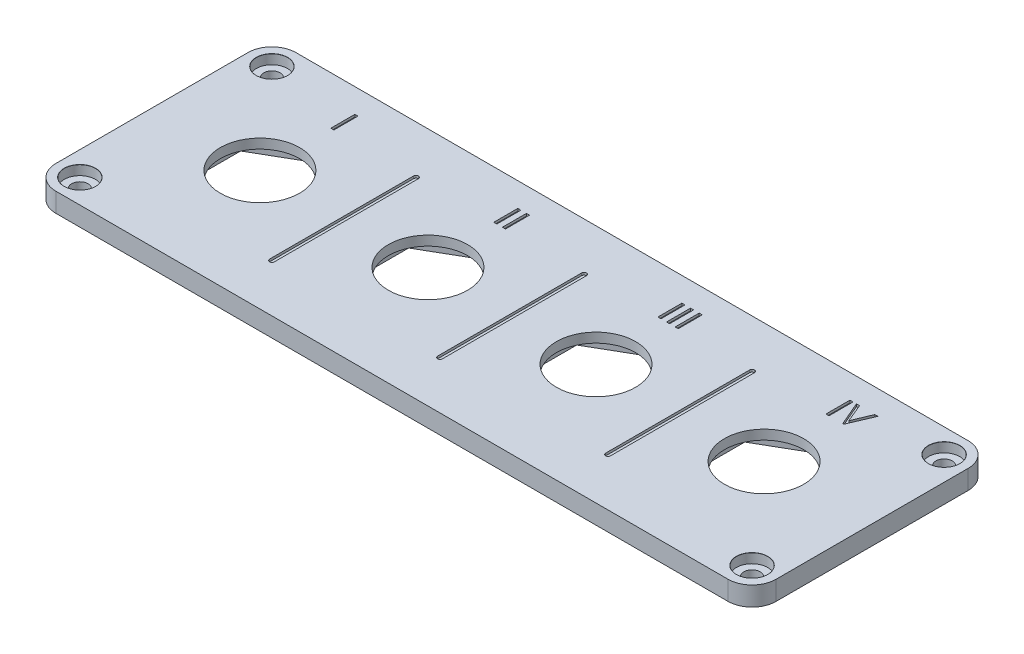
from build123d import *

# Parameters (mm, degrees)
SKETCH1_W              = 150
SKETCH1_H              = 50
BODY_DEPTH             = 4
EDGE_FILLETS_R         = 5
GX16_HOLE_D            = 16.5
GX16_NUT_CUTOUT_DEPTH  = 2
GX16_PATTERN_COUNT     = 4
GX16_PATTERN_PITCH     = 35
DESIGN_CUTOUT_SKETCH_W = 0.641025641
DESIGN_CUTOUT_SKETCH_H = 5
DESIGN_CUTOUT_DEPTH    = 0.5


# Read off the part's stored shape, not the designer's step: mounting_holes
with BuildPart() as part:
    # Sketch1 → body (new body)
    with BuildSketch(Plane(origin=(0, 0, 0), x_dir=(1, 0, 0), z_dir=(0, 1, 0))):
        Rectangle(SKETCH1_W, SKETCH1_H)
    extrude(amount=BODY_DEPTH)

    # mounting_holes outline → mounting_holes (revolve, cut)
    with BuildSketch(Plane(origin=(70, 0, 20), x_dir=(1, 0, 0), z_dir=(0, 0, 1))):
        Polygon((0, 0), (1.7, 0), (1.7, 2), (3.25, 2), (3.25, 3.975), (3.275, 4), (0, 4), align=None)
    revolve(axis=Axis((70, 0, 20), (0, 1, 0)), mode=Mode.SUBTRACT)

    # mounting_holes 2 outline → mounting_holes 2 (revolve, cut)
    with BuildSketch(Plane(origin=(-70, 0, -20), x_dir=(1, 0, 0), z_dir=(0, 0, 1))):
        Polygon((0, 4), (0, 0), (1.7, 0), (1.7, 2), (3.25, 2), (3.25, 3.975), (3.275, 4), align=None)
    revolve(axis=Axis((-70, 0, -20), (0, 1, 0)), mode=Mode.SUBTRACT)

    # mounting_holes 3 outline → mounting_holes 3 (revolve, cut)
    with BuildSketch(Plane(origin=(70, 0, -20), x_dir=(1, 0, 0), z_dir=(0, 0, 1))):
        Polygon((0, 4), (0, 0), (1.7, 0), (1.7, 2), (3.25, 2), (3.25, 3.975), (3.275, 4), align=None)
    revolve(axis=Axis((70, 0, -20), (0, 1, 0)), mode=Mode.SUBTRACT)

    # mounting_holes 4 outline → mounting_holes 4 (revolve, cut)
    with BuildSketch(Plane(origin=(-70, 0, 20), x_dir=(1, 0, 0), z_dir=(0, 0, 1))):
        Polygon((0, 4), (0, 0), (1.7, 0), (1.7, 2), (3.25, 2), (3.25, 3.975), (3.275, 4), align=None)
    revolve(axis=Axis((-70, 0, 20), (0, 1, 0)), mode=Mode.SUBTRACT)

    # edge_fillets
    edge_fillets_edges = [part.edges().sort_by_distance(p)[0] for p in [
        (75, 2, 25),
        (-75, 2, 25),
        (-75, 2, -25),
        (75, 2, -25),
    ]]
    fillet(edge_fillets_edges, radius=EDGE_FILLETS_R)

    # gx16_hole (through all)
    with Locations(Plane(origin=(0, 4, 0), x_dir=(1, 0, 0), z_dir=(0, 1, 0))):
        with Locations((-52.5, 0)):
            gx16_hole = Hole(GX16_HOLE_D / 2)

    # Sketch6 → gx16_nut-cutout (cut)
    with BuildSketch(Plane.XZ):
        Polygon((-52.5, 10.969655115), (-62, 5.484827557), (-62, -5.484827557), (-52.5, -10.969655115), (-43, -5.484827557), (-43, 5.484827557), align=None)
    gx16_nut_cutout = extrude(amount=-GX16_NUT_CUTOUT_DEPTH, mode=Mode.SUBTRACT)

    # gx16_pattern: gx16_hole, gx16_nut-cutout ×4
    with Locations(*[(i * GX16_PATTERN_PITCH, 0, 0) for i in range(1, GX16_PATTERN_COUNT)]):
        add(gx16_hole, mode=Mode.SUBTRACT)
        add(gx16_nut_cutout, mode=Mode.SUBTRACT)

    # design_cutout_sketch → design_cutout (cut)
    with BuildSketch(Plane(origin=(0, 4, 0), x_dir=(1, 0, 0), z_dir=(0, 1, 0))):
        with BuildLine():
            Line((-34.5, 15), (-34.5, -15))
            ThreePointArc((-34.5, -15), (-35, -15.5), (-35.5, -15))
            Line((-35.5, -15), (-35.5, 15))
            ThreePointArc((-35.5, 15), (-35, 15.5), (-34.5, 15))
        make_face()
        with BuildLine():
            Line((0.5, 15), (0.5, -15))
            ThreePointArc((0.5, -15), (0, -15.5), (-0.5, -15))
            Line((-0.5, -15), (-0.5, 15))
            ThreePointArc((-0.5, 15), (0, 15.5), (0.5, 15))
        make_face()
        with BuildLine():
            Line((35.5, 15), (35.5, -15))
            ThreePointArc((35.5, -15), (35, -15.5), (34.5, -15))
            Line((34.5, -15), (34.5, 15))
            ThreePointArc((34.5, 15), (35, 15.5), (35.5, 15))
        make_face()
        with Locations((-52.403846154, 17.5)):
            Rectangle(DESIGN_CUTOUT_SKETCH_W, DESIGN_CUTOUT_SKETCH_H)
        with Locations((-18.46923077, 17.5)):
            Rectangle(DESIGN_CUTOUT_SKETCH_W, DESIGN_CUTOUT_SKETCH_H)
        with Locations((-16.674358975, 17.5)):
            Rectangle(DESIGN_CUTOUT_SKETCH_W, DESIGN_CUTOUT_SKETCH_H)
        with Locations((15.711538462, 17.5)):
            Rectangle(DESIGN_CUTOUT_SKETCH_W, DESIGN_CUTOUT_SKETCH_H)
        with Locations((17.506410257, 17.5)):
            Rectangle(DESIGN_CUTOUT_SKETCH_W, DESIGN_CUTOUT_SKETCH_H)
        with Locations((19.301282052, 17.5)):
            Rectangle(DESIGN_CUTOUT_SKETCH_W, DESIGN_CUTOUT_SKETCH_H)
        with Locations((50.711538462, 17.5)):
            Rectangle(DESIGN_CUTOUT_SKETCH_W, DESIGN_CUTOUT_SKETCH_H)
        Polygon((51.737179487, 20), (52.382211538, 20), (53.976762821, 16.166866987), (55.571314103, 20), (56.224358974, 20), (54.079927885, 15), (53.874599359, 15), align=None)
    extrude(amount=-DESIGN_CUTOUT_DEPTH, mode=Mode.SUBTRACT)


solid = part.part
